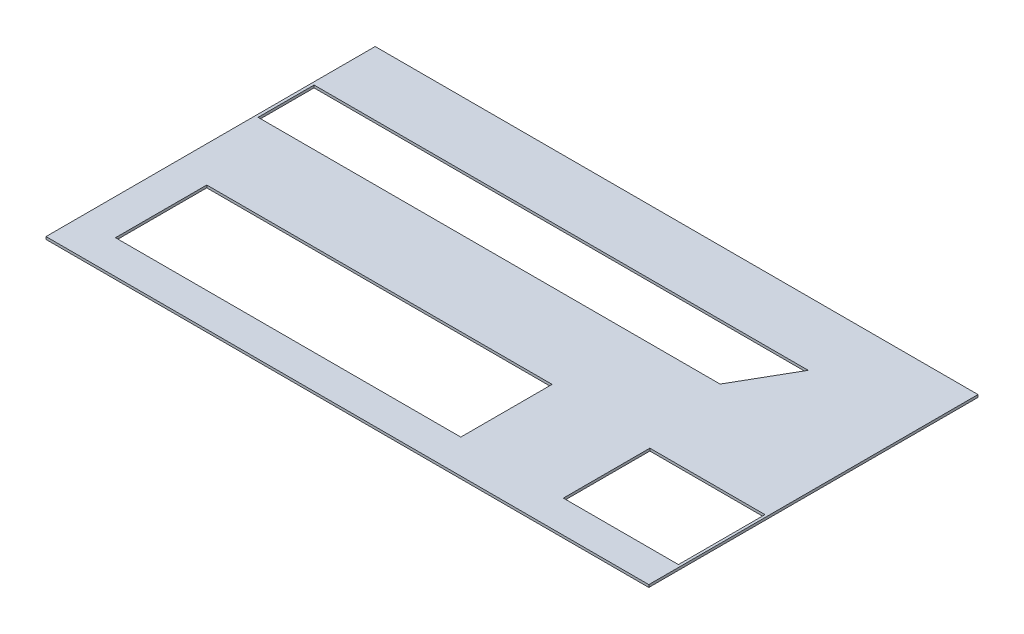
from build123d import *

# Parameters (mm, degrees)
SKETCH1_W           = 1518.68
SKETCH1_H           = 829.31
BOSS_EXTRUDE1_DEPTH = 6.35
CUT_EXTRUDE1_REACH  = 1732.371
SKETCH2_W           = 870
SKETCH2_H           = 230
SKETCH2_W_2         = 290
SKETCH2_H_2         = 218


with BuildPart() as part:
    # Sketch1 → Boss-Extrude1 (new body)
    with BuildSketch(Plane(origin=(0, 0, 0), x_dir=(1, 0, 0), z_dir=(0, 1, 0))):
        with Locations((759.34, 414.655)):
            Rectangle(SKETCH1_W, SKETCH1_H)
    extrude(amount=BOSS_EXTRUDE1_DEPTH)

    # Sketch2 → Cut-Extrude1 (cut, up to next)
    with BuildSketch(Plane(origin=(0, 6.35, 0), x_dir=(1, 0, 0), z_dir=(0, 1, 0)), mode=Mode.PRIVATE) as cut_extrude1_sk1:
        with Locations((525, 200)):
            Rectangle(SKETCH2_W, SKETCH2_H)
    cut_extrude1_tool1 = extrude(cut_extrude1_sk1.sketch, amount=-CUT_EXTRUDE1_REACH, mode=Mode.PRIVATE) & part.part
    # Sketch2 → Cut-Extrude1 (cut, up to next)
    with BuildSketch(Plane(origin=(0, 6.35, 0), x_dir=(1, 0, 0), z_dir=(0, 1, 0)), mode=Mode.PRIVATE) as cut_extrude1_sk2:
        Polygon((7, 668.31), (1252, 668.31), (1171, 527.31), (7, 527.31), align=None)
    cut_extrude1_tool2 = extrude(cut_extrude1_sk2.sketch, amount=-CUT_EXTRUDE1_REACH, mode=Mode.PRIVATE) & part.part
    # Sketch2 → Cut-Extrude1 (cut, up to next)
    with BuildSketch(Plane(origin=(0, 6.35, 0), x_dir=(1, 0, 0), z_dir=(0, 1, 0)), mode=Mode.PRIVATE) as cut_extrude1_sk3:
        with Locations((1367.33, 190)):
            Rectangle(SKETCH2_W_2, SKETCH2_H_2)
    cut_extrude1_tool3 = extrude(cut_extrude1_sk3.sketch, amount=-CUT_EXTRUDE1_REACH, mode=Mode.PRIVATE) & part.part
    add(cut_extrude1_tool1.solids().sort_by_distance((525, 6.35, -200))[0], mode=Mode.SUBTRACT)
    add(cut_extrude1_tool2.solids().sort_by_distance((609.476961, 6.35, -598.600162))[0], mode=Mode.SUBTRACT)
    add(cut_extrude1_tool3.solids().sort_by_distance((1367.33, 6.35, -190))[0], mode=Mode.SUBTRACT)


solid = part.part
